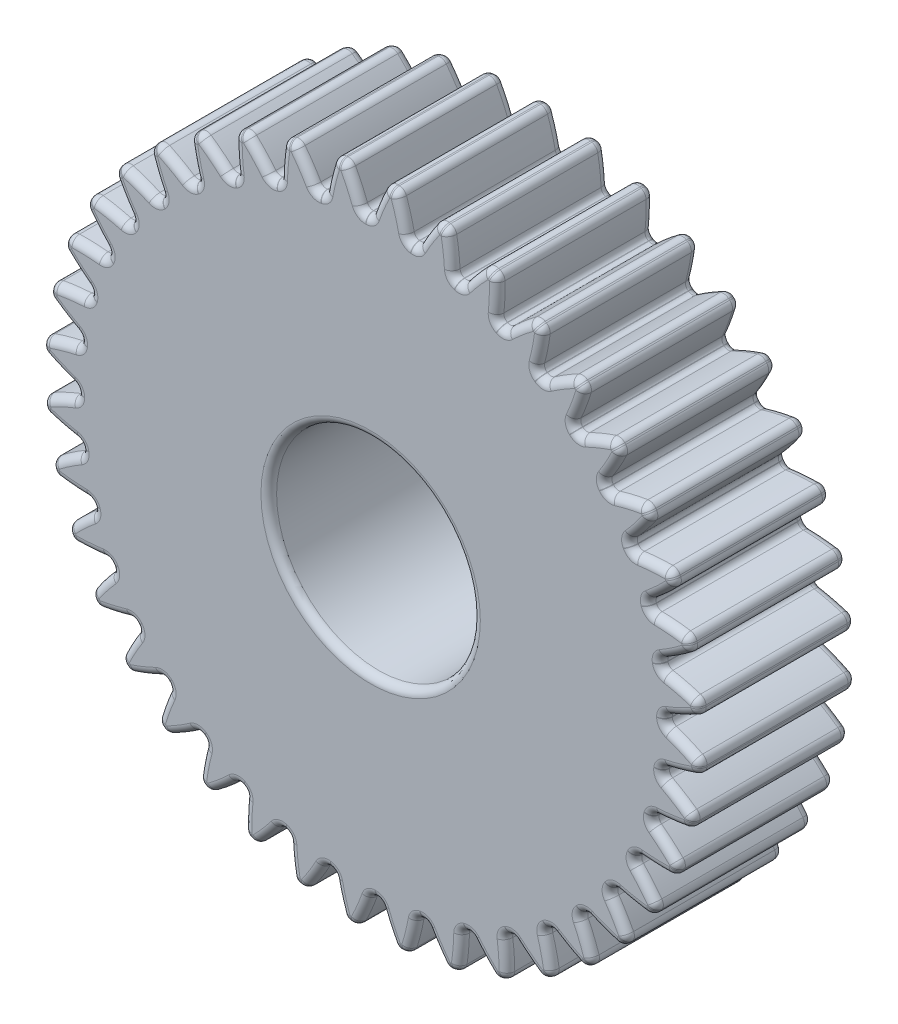
from build123d import *

# Parameters (mm, degrees)
SKETCH1_R                = 18.75
SKETCH1_R_2              = 6.5
BOSS_EXTRUDE5_DEPTH      = 10
BOSS_EXTRUDE6_DEPTH      = 10
FILLET3_R                = 0.5
FILLET4_R                = 0.4
CIRPATTERN5_COUNT        = 40
FILLET3_OF_CIRPATTERN5_R = 0.5
FILLET4_OF_CIRPATTERN5_R = 0.4
FILLET2_R                = 0.5
FILLET5_R                = 0.5


with BuildPart() as part:
    # Sketch1 → Boss-Extrude5 (new body)
    with BuildSketch(Plane(origin=(0, 0, 0), x_dir=(0, 1, 0), z_dir=(0, 0, 1))):
        with Locations(Location((0, 0, 0), (0, 0, 270))):
            Circle(SKETCH1_R)
        with Locations(Location((0, 0, 0), (0, 0, 270))):
            Circle(SKETCH1_R_2, mode=Mode.SUBTRACT)
    extrude(amount=BOSS_EXTRUDE5_DEPTH)

    # Sketch2 → Boss-Extrude6 (add)
    with BuildSketch(Plane(origin=(0, 0, 0), x_dir=(0, 1, 0), z_dir=(0, 0, 1))):
        with BuildLine():
            Line((2.32803618, 18.649105506), (2.322604084, 18.605590834))
            ThreePointArc((2.322604084, 18.605590834), (1.163544556, 18.713862885), (0, 18.75))
            Line((0, 18.75), (0, 18.793852416))
            ThreePointArc((0, 18.793852416), (0.418550324, 19.90662326), (0.931097056, 20.979348376))
            ThreePointArc((0.931097056, 20.979348376), (1.303169903, 20.959526431), (1.6748325, 20.933106222))
            ThreePointArc((1.6748325, 20.933106222), (2.050550849, 19.805152744), (2.32803618, 18.649105506))
        make_face()
    boss_extrude6 = extrude(amount=BOSS_EXTRUDE6_DEPTH)

    # Fillet3
    # the kernel refuses this fillet: 0.5 mm, written as the material it takes off along each edge
    with BuildSketch(Plane(origin=(-20.933106222, 1.6748325, -0.821430586), x_dir=(0.9384624251932158, 0.3453813493813292, 0), z_dir=(0, 0, 1))) as fillet3_piece_1:
        with BuildLine():
            CenterArc((0.322634488, -0.499964742), FILLET3_R, 89.31956844, 66.791728158)
            Line((-0.13453242, -0.297484081), (-0.143675758, -0.293434468))
            ThreePointArc((-0.143675758, -0.293434468), (-0.076955929, -0.14436002), (-0.009079275, 0.004191272))
            Line((-0.009079275, 0.004191272), (-0.000118755, 0.009999295))
            ThreePointArc((-0.000118755, 0.009999295), (0.164286117, 0.010975524), (0.328690989, 0.009999295))
            Line((0.328690989, 0.009999295), (0.328572234, 0))
        make_face()
    extrude(amount=11.642861172, mode=Mode.SUBTRACT)
    with BuildSketch(Plane(origin=(-20.979348376, 0.931097056, -0.821430586), x_dir=(0.05210254330850635, 0.998641740055354, 0), z_dir=(0, 0, 1))) as fillet3_piece_2:
        with BuildLine():
            CenterArc((0.32260326, -0.499984893), FILLET3_R, 89.554602616, 66.791728158)
            Line((-0.135390399, -0.299381284), (-0.144550273, -0.295369211))
            ThreePointArc((-0.144550273, -0.295369211), (-0.077695638, -0.145168103), (-0.009062006, 0.004228481))
            Line((-0.009062006, 0.004228481), (-7.7736e-05, 0.009999698))
            ThreePointArc((-7.7736e-05, 0.009999698), (0.163245023, 0.010634508), (0.326567782, 0.009999698))
            Line((0.326567782, 0.009999698), (0.326490046, 0))
        make_face()
    extrude(amount=11.642861172, mode=Mode.SUBTRACT)
    with BuildSketch(Plane(origin=(-18.793852416, 0, -0.190778807), x_dir=(1, 0, 0), z_dir=(0, 0, 1))) as fillet3_piece_3:
        with BuildLine():
            CenterArc((0.085924658, 0.498226782), FILLET3_R, 251.533712478, 13.639456333)
            Line((-0.072448649, 0.023971687), (-0.075616115, 0.014486585))
            ThreePointArc((-0.075616115, 0.014486585), (-0.039382147, 0.002442086), (-0.003115096, -0.00950243))
            Line((-0.003115096, -0.00950243), (0, -0.01))
            ThreePointArc((0, -0.01), (0.021926208, -0.01), (0.043010971, -0.009964536))
            Line((0.043010971, -0.009964536), (0.043852416, 0))
        make_face()
    extrude(amount=10.381557614, mode=Mode.SUBTRACT)
    with BuildSketch(Plane(origin=(-18.649105506, 2.32803618, -0.190778807), x_dir=(0.9922981777936071, -0.12387221781936024, 0), z_dir=(0, 0, 1))) as fillet3_piece_4:
        with BuildLine():
            CenterArc((0.085924658, -0.498226782), FILLET3_R, 94.826831189, 13.639456333)
            Line((-0.072448649, -0.023971687), (-0.075616115, -0.014486585))
            ThreePointArc((-0.075616115, -0.014486585), (-0.039382147, -0.002442086), (-0.003115096, 0.00950243))
            Line((-0.003115096, 0.00950243), (0, 0.01))
            ThreePointArc((0, 0.01), (0.021926208, 0.01), (0.043010971, 0.009964536))
            Line((0.043010971, 0.009964536), (0.043852416, 0))
        make_face()
    extrude(amount=10.381557614, mode=Mode.SUBTRACT)

    # Fillet4
    fillet4_edges = [part.edges().sort_by_distance(p)[0] for p in [
        (-18.75, 0, 5),
        (-18.605590834, 2.322604084, 5),
    ]]
    fillet(fillet4_edges, radius=FILLET4_R)

    # CirPattern5: Boss-Extrude6 ×40 about axis
    cirpattern5_axis = Axis((0, 0, 0), (0, 0, 1))
    for i in range(1, CIRPATTERN5_COUNT):
        add(boss_extrude6.rotate(cirpattern5_axis, i * 360 / CIRPATTERN5_COUNT))

    # Fillet3 of CirPattern5
    # the kernel refuses this fillet: 0.5 mm, written as the material it takes off along each edge
    with BuildSketch(Plane(origin=(-20.937386474, -1.620446741, -0.821430586), x_dir=(0.8728788488246356, 0.48793699928841117, 0), z_dir=(0, 0, 1)), Plane(origin=(-20.426118784, -4.875825205, -0.821430586), x_dir=(0.7858020982791726, 0.618478020902966, 0), z_dir=(0, 0, 1)), Plane(origin=(-19.411892259, -8.011144671, -0.821430586), x_dir=(0.6793762921464435, 0.7337900610320028, 0), z_dir=(0, 0, 1)), Plane(origin=(-17.919680522, -10.949203167, -0.821430586), x_dir=(0.5562219869804215, 0.8310337545488461, 0), z_dir=(0, 0, 1)), Plane(origin=(-15.986226779, -13.617655943, -0.821430586), x_dir=(0.419371650499999, 0.9078146389857936, 0), z_dir=(0, 0, 1)), Plane(origin=(-13.659139077, -15.950796835, -0.821430586), x_dir=(0.27219499216956267, 0.9622421141468562, 0), z_dir=(0, 0, 1)), Plane(origin=(-10.995718039, -17.891176172, -0.821430586), x_dir=(0.11831598976850975, 0.992975994959142, 0), z_dir=(0, 0, 1)), Plane(origin=(-8.06154593, -19.391015374, -0.821430586), x_dir=(-0.038476344968887695, 0.9992595112771432, 0), z_dir=(0, 0, 1)), Plane(origin=(-4.928871806, -20.413383422, -0.821430586), x_dir=(-0.19432126439748915, 0.9809379420753186, 0), z_dir=(0, 0, 1)), Plane(origin=(-1.6748325, -20.933106222, -0.821430586), x_dir=(-0.34538134938133047, 0.9384624251932153, 0), z_dir=(0, 0, 1)), Plane(origin=(1.620446741, -20.937386474, -0.821430586), x_dir=(-0.48793699928841117, 0.8728788488246356, 0), z_dir=(0, 0, 1)), Plane(origin=(4.875825205, -20.426118784, -0.821430586), x_dir=(-0.6184780209029541, 0.7858020982791819, 0), z_dir=(0, 0, 1)), Plane(origin=(8.011144671, -19.411892259, -0.821430586), x_dir=(-0.7337900610319971, 0.6793762921464497, 0), z_dir=(0, 0, 1)), Plane(origin=(10.949203167, -17.919680522, -0.821430586), x_dir=(-0.8310337545488444, 0.556221986980424, 0), z_dir=(0, 0, 1)), Plane(origin=(13.617655943, -15.986226779, -0.821430586), x_dir=(-0.9078146389857953, 0.41937165049999525, 0), z_dir=(0, 0, 1)), Plane(origin=(15.950796835, -13.659139077, -0.821430586), x_dir=(-0.9622421141468571, 0.2721949921695599, 0), z_dir=(0, 0, 1)), Plane(origin=(17.891176172, -10.995718039, -0.821430586), x_dir=(-0.9929759949591412, 0.11831598976851661, 0), z_dir=(0, 0, 1)), Plane(origin=(19.391015374, -8.06154593, -0.821430586), x_dir=(-0.999259511277143, -0.038476344968893926, 0), z_dir=(0, 0, 1)), Plane(origin=(20.413383422, -4.928871806, -0.821430586), x_dir=(-0.9809379420753189, -0.19432126439748706, 0), z_dir=(0, 0, 1)), Plane(origin=(20.933106222, -1.6748325, -0.821430586), x_dir=(-0.9384624251932158, -0.3453813493813292, 0), z_dir=(0, 0, 1)), Plane(origin=(20.937386474, 1.620446741, -0.821430586), x_dir=(-0.8728788488246382, -0.48793699928840656, 0), z_dir=(0, 0, 1)), Plane(origin=(20.426118784, 4.875825205, -0.821430586), x_dir=(-0.785802098279173, -0.6184780209029656, 0), z_dir=(0, 0, 1)), Plane(origin=(19.411892259, 8.011144671, -0.821430586), x_dir=(-0.6793762921464492, -0.7337900610319974, 0), z_dir=(0, 0, 1)), Plane(origin=(17.919680522, 10.949203167, -0.821430586), x_dir=(-0.556221986980419, -0.8310337545488478, 0), z_dir=(0, 0, 1)), Plane(origin=(15.986226779, 13.617655943, -0.821430586), x_dir=(-0.4193716505000007, -0.9078146389857927, 0), z_dir=(0, 0, 1)), Plane(origin=(13.659139077, 15.950796835, -0.821430586), x_dir=(-0.27219499216955834, -0.9622421141468576, 0), z_dir=(0, 0, 1)), Plane(origin=(10.995718039, 17.891176172, -0.821430586), x_dir=(-0.11831598976850594, -0.9929759949591423, 0), z_dir=(0, 0, 1)), Plane(origin=(8.06154593, 19.391015374, -0.821430586), x_dir=(0.0384763449688985, -0.9992595112771427, 0), z_dir=(0, 0, 1)), Plane(origin=(4.928871806, 20.413383422, -0.821430586), x_dir=(0.19432126439748915, -0.9809379420753186, 0), z_dir=(0, 0, 1)), Plane(origin=(1.6748325, 20.933106222, -0.821430586), x_dir=(0.34538134938132325, -0.9384624251932181, 0), z_dir=(0, 0, 1)), Plane(origin=(-1.620446741, 20.937386474, -0.821430586), x_dir=(0.48793699928840656, -0.8728788488246382, 0), z_dir=(0, 0, 1)), Plane(origin=(-4.875825205, 20.426118784, -0.821430586), x_dir=(0.6184780209029569, -0.7858020982791797, 0), z_dir=(0, 0, 1)), Plane(origin=(-8.011144671, 19.411892259, -0.821430586), x_dir=(0.7337900610320007, -0.6793762921464457, 0), z_dir=(0, 0, 1)), Plane(origin=(-10.949203167, 17.919680522, -0.821430586), x_dir=(0.8310337545488444, -0.556221986980424, 0), z_dir=(0, 0, 1)), Plane(origin=(-13.617655943, 15.986226779, -0.821430586), x_dir=(0.9078146389857934, -0.41937165049999897, 0), z_dir=(0, 0, 1)), Plane(origin=(-15.950796835, 13.659139077, -0.821430586), x_dir=(0.9622421141468571, -0.2721949921695599, 0), z_dir=(0, 0, 1)), Plane(origin=(-17.891176172, 10.995718039, -0.821430586), x_dir=(0.9929759949591414, -0.11831598976851379, 0), z_dir=(0, 0, 1)), Plane(origin=(-19.391015374, 8.06154593, -0.821430586), x_dir=(0.999259511277143, 0.038476344968893926, 0), z_dir=(0, 0, 1))) as fillet3_of_cirpattern5_piece_1:
        with BuildLine():
            CenterArc((0.322634488, -0.499964742), FILLET3_OF_CIRPATTERN5_R, 89.31956844, 66.791728158)
            Line((-0.13453242, -0.297484081), (-0.143675758, -0.293434468))
            ThreePointArc((-0.143675758, -0.293434468), (-0.076955929, -0.14436002), (-0.009079275, 0.004191272))
            Line((-0.009079275, 0.004191272), (-0.000118755, 0.009999295))
            ThreePointArc((-0.000118755, 0.009999295), (0.164286117, 0.010975524), (0.328690989, 0.009999295))
            Line((0.328690989, 0.009999295), (0.328572234, 0))
        make_face()
    extrude(amount=11.642861172, mode=Mode.SUBTRACT)
    with BuildSketch(Plane(origin=(-20.866713454, -2.362259434, -0.821430586), x_dir=(-0.10476091183123108, 0.994497436574016, 0), z_dir=(0, 0, 1)), Plane(origin=(-20.240270794, -5.597449257, -0.821430586), x_dir=(-0.2590448056401441, 0.9658653056564668, 0), z_dir=(0, 0, 1)), Plane(origin=(-19.115445494, -8.694811302, -0.821430586), x_dir=(-0.4069501566137963, 0.9134503653904829, 0), z_dir=(0, 0, 1)), Plane(origin=(-17.519934485, -11.578078236, -0.821430586), x_dir=(-0.5448350441414761, 0.8385432455606305, 0), z_dir=(0, 0, 1)), Plane(origin=(-15.493024544, -14.176254459, -0.821430586), x_dir=(-0.6693042846785545, 0.7429884080595932, 0), z_dir=(0, 0, 1)), Plane(origin=(-13.08462492, -16.425364249, -0.821430586), x_dir=(-0.777293032433268, 0.629138730114984, 0), z_dir=(0, 0, 1)), Plane(origin=(-10.354038405, -18.270027058, -0.821430586), x_dir=(-0.8661422460418021, 0.4997975686432082, 0), z_dir=(0, 0, 1)), Plane(origin=(-7.368501101, -19.664821167, -0.821430586), x_dir=(-0.9336641629914852, 0.35814973229839075, 0), z_dir=(0, 0, 1)), Plane(origin=(-4.201526846, -20.575402114, -0.821430586), x_dir=(-0.9781961695946072, 0.20768306091359082, 0), z_dir=(0, 0, 1)), Plane(origin=(-0.931097056, -20.979348376, -0.821430586), x_dir=(-0.9986417400553536, 0.05210254330851695, 0), z_dir=(0, 0, 1)), Plane(origin=(2.362259434, -20.866713454, -0.821430586), x_dir=(-0.994497436574016, -0.10476091183123051, 0), z_dir=(0, 0, 1)), Plane(origin=(5.597449257, -20.240270794, -0.821430586), x_dir=(-0.9658653056564642, -0.2590448056401536, 0), z_dir=(0, 0, 1)), Plane(origin=(8.694811302, -19.115445494, -0.821430586), x_dir=(-0.9134503653904829, -0.4069501566137963, 0), z_dir=(0, 0, 1)), Plane(origin=(11.578078236, -17.519934485, -0.821430586), x_dir=(-0.8385432455606239, -0.5448350441414864, 0), z_dir=(0, 0, 1)), Plane(origin=(14.176254459, -15.493024544, -0.821430586), x_dir=(-0.7429884080595961, -0.6693042846785512, 0), z_dir=(0, 0, 1)), Plane(origin=(16.425364249, -13.08462492, -0.821430586), x_dir=(-0.6291387301149892, -0.7772930324332638, 0), z_dir=(0, 0, 1)), Plane(origin=(18.270027058, -10.354038405, -0.821430586), x_dir=(-0.4997975686432082, -0.8661422460418021, 0), z_dir=(0, 0, 1)), Plane(origin=(19.664821167, -7.368501101, -0.821430586), x_dir=(-0.3581497322983939, -0.9336641629914841, 0), z_dir=(0, 0, 1)), Plane(origin=(20.575402114, -4.201526846, -0.821430586), x_dir=(-0.20768306091359362, -0.9781961695946068, 0), z_dir=(0, 0, 1)), Plane(origin=(20.979348376, -0.931097056, -0.821430586), x_dir=(-0.052102543308517026, -0.9986417400553536, 0), z_dir=(0, 0, 1)), Plane(origin=(20.866713454, 2.362259434, -0.821430586), x_dir=(0.10476091183123037, -0.994497436574016, 0), z_dir=(0, 0, 1)), Plane(origin=(20.240270794, 5.597449257, -0.821430586), x_dir=(0.2590448056401421, -0.9658653056564674, 0), z_dir=(0, 0, 1)), Plane(origin=(19.115445494, 8.694811302, -0.821430586), x_dir=(0.4069501566137963, -0.9134503653904829, 0), z_dir=(0, 0, 1)), Plane(origin=(17.519934485, 11.578078236, -0.821430586), x_dir=(0.5448350441414838, -0.8385432455606255, 0), z_dir=(0, 0, 1)), Plane(origin=(15.493024544, 14.176254459, -0.821430586), x_dir=(0.6693042846785542, -0.7429884080595934, 0), z_dir=(0, 0, 1)), Plane(origin=(13.08462492, 16.425364249, -0.821430586), x_dir=(0.7772930324332648, -0.629138730114988, 0), z_dir=(0, 0, 1)), Plane(origin=(10.354038405, 18.270027058, -0.821430586), x_dir=(0.8661422460418056, -0.4997975686432024, 0), z_dir=(0, 0, 1)), Plane(origin=(7.368501101, 19.664821167, -0.821430586), x_dir=(0.9336641629914857, -0.35814973229838987, 0), z_dir=(0, 0, 1)), Plane(origin=(4.201526846, 20.575402114, -0.821430586), x_dir=(0.9781961695946071, -0.20768306091359195, 0), z_dir=(0, 0, 1)), Plane(origin=(0.931097056, 20.979348376, -0.821430586), x_dir=(0.9986417400553536, -0.0521025433085175, 0), z_dir=(0, 0, 1)), Plane(origin=(-2.362259434, 20.866713454, -0.821430586), x_dir=(0.994497436574016, 0.10476091183123051, 0), z_dir=(0, 0, 1)), Plane(origin=(-5.597449257, 20.240270794, -0.821430586), x_dir=(0.965865305656465, 0.25904480564015087, 0), z_dir=(0, 0, 1)), Plane(origin=(-8.694811302, 19.115445494, -0.821430586), x_dir=(0.9134503653904787, 0.4069501566138054, 0), z_dir=(0, 0, 1)), Plane(origin=(-11.578078236, 17.519934485, -0.821430586), x_dir=(0.8385432455606221, 0.5448350441414889, 0), z_dir=(0, 0, 1)), Plane(origin=(-14.176254459, 15.493024544, -0.821430586), x_dir=(0.7429884080595938, 0.6693042846785539, 0), z_dir=(0, 0, 1)), Plane(origin=(-16.425364249, 13.08462492, -0.821430586), x_dir=(0.6291387301149892, 0.7772930324332638, 0), z_dir=(0, 0, 1)), Plane(origin=(-18.270027058, 10.354038405, -0.821430586), x_dir=(0.49979756864319763, 0.8661422460418081, 0), z_dir=(0, 0, 1)), Plane(origin=(-19.664821167, 7.368501101, -0.821430586), x_dir=(0.35814973229838715, 0.9336641629914868, 0), z_dir=(0, 0, 1)), Plane(origin=(-20.575402114, 4.201526846, -0.821430586), x_dir=(0.2076830609135903, 0.9781961695946074, 0), z_dir=(0, 0, 1))) as fillet3_of_cirpattern5_piece_2:
        with BuildLine():
            CenterArc((0.32260326, -0.499984893), FILLET3_OF_CIRPATTERN5_R, 89.554602616, 66.791728158)
            Line((-0.135390399, -0.299381284), (-0.144550273, -0.295369211))
            ThreePointArc((-0.144550273, -0.295369211), (-0.077695638, -0.145168103), (-0.009062006, 0.004228481))
            Line((-0.009062006, 0.004228481), (-7.7736e-05, 0.009999698))
            ThreePointArc((-7.7736e-05, 0.009999698), (0.163245023, 0.010634508), (0.326567782, 0.009999698))
            Line((0.326567782, 0.009999698), (0.326490046, 0))
        make_face()
    extrude(amount=11.642861172, mode=Mode.SUBTRACT)
    with BuildSketch(Plane(origin=(-18.562468906, -2.940006249, -0.190778807), x_dir=(-0.9868324100223466, 0.16174608041460278, 0), z_dir=(0, 0, 1)), Plane(origin=(-16.745445117, -8.53223045, -0.190778807), x_dir=(-0.9885156816646515, -0.15111832153339072, 0), z_dir=(0, 0, 1)), Plane(origin=(-15.204545994, -11.046749284, -0.190778807), x_dir=(-0.9527052994887785, -0.3038957260739235, 0), z_dir=(0, 0, 1)), Plane(origin=(-13.289260488, -13.289260488, -0.190778807), x_dir=(-0.8934361509918739, -0.4491902092664371, 0), z_dir=(0, 0, 1)), Plane(origin=(-11.046749284, -15.204545994, -0.190778807), x_dir=(-0.812167639312964, -0.5834241387299699, 0), z_dir=(0, 0, 1)), Plane(origin=(-8.53223045, -16.745445117, -0.190778807), x_dir=(-0.7109008649243174, -0.7032922296242562, 0), z_dir=(0, 0, 1)), Plane(origin=(-5.807619786, -17.874015806, -0.190778807), x_dir=(-0.592129351896542, -0.805842931732097, 0), z_dir=(0, 0, 1)), Plane(origin=(-2.940006249, -18.562468906, -0.190778807), x_dir=(-0.45877764906038127, -0.8885511064213637, 0), z_dir=(0, 0, 1)), Plane(origin=(0, -18.793852416, -0.190778807), x_dir=(-0.3141293179087008, -0.9493802039384508, 0), z_dir=(0, 0, 1)), Plane(origin=(2.940006249, -18.562468906, -0.190778807), x_dir=(-0.16174608041459537, -0.9868324100223479, 0), z_dir=(0, 0, 1)), Plane(origin=(5.807619786, -17.874015806, -0.190778807), x_dir=(-0.0053801176162308825, -0.9999855270624848, 0), z_dir=(0, 0, 1)), Plane(origin=(8.53223045, -16.745445117, -0.190778807), x_dir=(0.15111832153338375, -0.9885156816646526, 0), z_dir=(0, 0, 1)), Plane(origin=(11.046749284, -15.204545994, -0.190778807), x_dir=(0.30389572607391585, -0.9527052994887807, 0), z_dir=(0, 0, 1)), Plane(origin=(13.289260488, -13.289260488, -0.190778807), x_dir=(0.44919020926643694, -0.893436150991874, 0), z_dir=(0, 0, 1)), Plane(origin=(15.204545994, -11.046749284, -0.190778807), x_dir=(0.5834241387299526, -0.8121676393129765, 0), z_dir=(0, 0, 1)), Plane(origin=(16.745445117, -8.53223045, -0.190778807), x_dir=(0.7032922296242673, -0.7109008649243064, 0), z_dir=(0, 0, 1)), Plane(origin=(17.874015806, -5.807619786, -0.190778807), x_dir=(0.8058429317321029, -0.5921293518965339, 0), z_dir=(0, 0, 1)), Plane(origin=(18.562468906, -2.940006249, -0.190778807), x_dir=(0.8885511064213542, -0.4587776490603996, 0), z_dir=(0, 0, 1)), Plane(origin=(18.793852416, 0, -0.190778807), x_dir=(0.9493802039384597, -0.31412931790867404, 0), z_dir=(0, 0, 1)), Plane(origin=(18.562468906, 2.940006249, -0.190778807), x_dir=(0.9868324100223466, -0.16174608041460278, 0), z_dir=(0, 0, 1)), Plane(origin=(17.874015806, 5.807619786, -0.190778807), x_dir=(0.9999855270624848, -0.0053801176162308825, 0), z_dir=(0, 0, 1)), Plane(origin=(16.745445117, 8.53223045, -0.190778807), x_dir=(0.9885156816646467, 0.15111832153342228, 0), z_dir=(0, 0, 1)), Plane(origin=(15.204545994, 11.046749284, -0.190778807), x_dir=(0.9527052994887738, 0.3038957260739379, 0), z_dir=(0, 0, 1)), Plane(origin=(13.289260488, 13.289260488, -0.190778807), x_dir=(0.8934361509918785, 0.449190209266428, 0), z_dir=(0, 0, 1)), Plane(origin=(11.046749284, 15.204545994, -0.190778807), x_dir=(0.8121676393129765, 0.5834241387299526, 0), z_dir=(0, 0, 1)), Plane(origin=(8.53223045, 16.745445117, -0.190778807), x_dir=(0.7109008649242824, 0.7032922296242916, 0), z_dir=(0, 0, 1)), Plane(origin=(5.807619786, 17.874015806, -0.190778807), x_dir=(0.5921293518965349, 0.8058429317321022, 0), z_dir=(0, 0, 1)), Plane(origin=(2.940006249, 18.562468906, -0.190778807), x_dir=(0.45877764906040025, 0.888551106421354, 0), z_dir=(0, 0, 1)), Plane(origin=(0, 18.793852416, -0.190778807), x_dir=(0.3141293179086672, 0.9493802039384618, 0), z_dir=(0, 0, 1)), Plane(origin=(-2.940006249, 18.562468906, -0.190778807), x_dir=(0.16174608041459537, 0.9868324100223479, 0), z_dir=(0, 0, 1)), Plane(origin=(-5.807619786, 17.874015806, -0.190778807), x_dir=(0.005380117616231384, 0.9999855270624848, 0), z_dir=(0, 0, 1)), Plane(origin=(-8.53223045, 16.745445117, -0.190778807), x_dir=(-0.15111832153341156, 0.9885156816646483, 0), z_dir=(0, 0, 1)), Plane(origin=(-11.046749284, 15.204545994, -0.190778807), x_dir=(-0.30389572607392934, 0.9527052994887765, 0), z_dir=(0, 0, 1)), Plane(origin=(-13.289260488, 13.289260488, -0.190778807), x_dir=(-0.44919020926642766, 0.8934361509918786, 0), z_dir=(0, 0, 1)), Plane(origin=(-15.204545994, 11.046749284, -0.190778807), x_dir=(-0.583424138729966, 0.8121676393129669, 0), z_dir=(0, 0, 1)), Plane(origin=(-16.745445117, 8.53223045, -0.190778807), x_dir=(-0.7032922296242916, 0.7109008649242824, 0), z_dir=(0, 0, 1)), Plane(origin=(-17.874015806, 5.807619786, -0.190778807), x_dir=(-0.8058429317321241, 0.5921293518965052, 0), z_dir=(0, 0, 1))) as fillet3_of_cirpattern5_piece_3:
        with BuildLine():
            CenterArc((0.07493247, -0.499998098), FILLET3_OF_CIRPATTERN5_R, 89.841971998, 13.639456333)
            Line((-0.041632615, -0.013775329), (-0.043963917, -0.004050874))
            ThreePointArc((-0.043963917, -0.004050874), (-0.023957601, 0.002606137), (-0.003141293, 0.009493802))
            Line((-0.003141293, 0.009493802), (-2.7581e-05, 0.009999962))
            ThreePointArc((-2.7581e-05, 0.009999962), (0.038155761, 0.010052619), (0.076339104, 0.009999962))
            Line((0.076339104, 0.009999962), (0.076311523, 0))
        make_face()
    extrude(amount=10.381557614, mode=Mode.SUBTRACT)
    with BuildSketch(Plane(origin=(-18.783689165, -0.617988652, -0.190778807), x_dir=(0.9994592247284663, 0.03288248933966567, 0), z_dir=(0, 0, 1)), Plane(origin=(-18.455756058, -3.548796552, -0.190778807), x_dir=(0.9820102685354974, 0.18882752048057064, 0), z_dir=(0, 0, 1)), Plane(origin=(-17.673380985, -6.392221303, -0.190778807), x_dir=(0.9403809604259679, 0.3401229913844905, 0), z_dir=(0, 0, 1)), Plane(origin=(-16.455828618, -9.078248352, -0.190778807), x_dir=(0.8755963521253076, 0.4830435054369887, 0), z_dir=(0, 0, 1)), Plane(origin=(-14.833079136, -11.540738796, -0.190778807), x_dir=(0.7892516556976134, 0.6140698852562109, 0), z_dir=(0, 0, 1)), Plane(origin=(-12.845090018, -13.719057951, -0.190778807), x_dir=(0.6834729641304829, 0.7299758265194073, 0), z_dir=(0, 0, 1)), Plane(origin=(-10.540812153, -15.559568367, -0.190778807), x_dir=(0.5608648998698184, 0.8279073402827266, 0), z_dir=(0, 0, 1)), Plane(origin=(-7.97698451, -17.016950571, -0.190778807), x_dir=(0.4244464803704946, 0.9054530276613466, 0), z_dir=(0, 0, 1)), Plane(origin=(-5.216737035, -18.055318976, -0.190778807), x_dir=(0.27757677986735146, 0.960703456472637, 0), z_dir=(0, 0, 1)), Plane(origin=(-2.32803618, -18.649105506, -0.190778807), x_dir=(0.12387221781932034, 0.992298177793612, 0), z_dir=(0, 0, 1)), Plane(origin=(0.617988652, -18.783689165, -0.190778807), x_dir=(-0.03288248933972597, 0.9994592247284643, 0), z_dir=(0, 0, 1)), Plane(origin=(3.548796552, -18.455756058, -0.190778807), x_dir=(-0.1888275204805323, 0.9820102685355048, 0), z_dir=(0, 0, 1)), Plane(origin=(6.392221303, -17.673380985, -0.190778807), x_dir=(-0.3401229913844227, 0.9403809604259925, 0), z_dir=(0, 0, 1)), Plane(origin=(9.078248352, -16.455828618, -0.190778807), x_dir=(-0.48304350543710656, 0.8755963521252428, 0), z_dir=(0, 0, 1)), Plane(origin=(11.540738796, -14.833079136, -0.190778807), x_dir=(-0.6140698852562165, 0.789251655697609, 0), z_dir=(0, 0, 1)), Plane(origin=(13.719057951, -12.845090018, -0.190778807), x_dir=(-0.7299758265193923, 0.683472964130499, 0), z_dir=(0, 0, 1)), Plane(origin=(15.559568367, -10.540812153, -0.190778807), x_dir=(-0.8279073402827012, 0.560864899869856, 0), z_dir=(0, 0, 1)), Plane(origin=(17.016950571, -7.97698451, -0.190778807), x_dir=(-0.905453027661336, 0.42444648037051746, 0), z_dir=(0, 0, 1)), Plane(origin=(18.055318976, -5.216737035, -0.190778807), x_dir=(-0.960703456472645, 0.2775767798673241, 0), z_dir=(0, 0, 1)), Plane(origin=(18.649105506, -2.32803618, -0.190778807), x_dir=(-0.992298177793612, 0.12387221781932034, 0), z_dir=(0, 0, 1)), Plane(origin=(18.783689165, 0.617988652, -0.190778807), x_dir=(-0.999459224728463, -0.03288248933975871, 0), z_dir=(0, 0, 1)), Plane(origin=(18.455756058, 3.548796552, -0.190778807), x_dir=(-0.9820102685355058, -0.18882752048052703, 0), z_dir=(0, 0, 1)), Plane(origin=(17.673380985, 6.392221303, -0.190778807), x_dir=(-0.9403809604259635, -0.3401229913845023, 0), z_dir=(0, 0, 1)), Plane(origin=(16.455828618, 9.078248352, -0.190778807), x_dir=(-0.8755963521252942, -0.4830435054370134, 0), z_dir=(0, 0, 1)), Plane(origin=(14.833079136, 11.540738796, -0.190778807), x_dir=(-0.7892516556975849, -0.6140698852562473, 0), z_dir=(0, 0, 1)), Plane(origin=(12.845090018, 13.719057951, -0.190778807), x_dir=(-0.6834729641304773, -0.7299758265194124, 0), z_dir=(0, 0, 1)), Plane(origin=(10.540812153, 15.559568367, -0.190778807), x_dir=(-0.5608648998698372, -0.8279073402827138, 0), z_dir=(0, 0, 1)), Plane(origin=(7.97698451, 17.016950571, -0.190778807), x_dir=(-0.42444648037047794, -0.9054530276613543, 0), z_dir=(0, 0, 1)), Plane(origin=(5.216737035, 18.055318976, -0.190778807), x_dir=(-0.2775767798672464, -0.9607034564726673, 0), z_dir=(0, 0, 1)), Plane(origin=(2.32803618, 18.649105506, -0.190778807), x_dir=(-0.12387221781932038, -0.9922981777936121, 0), z_dir=(0, 0, 1)), Plane(origin=(-0.617988652, 18.783689165, -0.190778807), x_dir=(0.03288248933972077, -0.9994592247284644, 0), z_dir=(0, 0, 1)), Plane(origin=(-3.548796552, 18.455756058, -0.190778807), x_dir=(0.18882752048055634, -0.9820102685355001, 0), z_dir=(0, 0, 1)), Plane(origin=(-6.392221303, 17.673380985, -0.190778807), x_dir=(0.34012299138441093, -0.9403809604259967, 0), z_dir=(0, 0, 1)), Plane(origin=(-9.078248352, 16.455828618, -0.190778807), x_dir=(0.48304350543704444, -0.875596352125277, 0), z_dir=(0, 0, 1)), Plane(origin=(-11.540738796, 14.833079136, -0.190778807), x_dir=(0.6140698852562642, -0.7892516556975719, 0), z_dir=(0, 0, 1)), Plane(origin=(-13.719057951, 12.845090018, -0.190778807), x_dir=(0.7299758265194313, -0.683472964130457, 0), z_dir=(0, 0, 1)), Plane(origin=(-15.559568367, 10.540812153, -0.190778807), x_dir=(0.8279073402827206, -0.5608648998698273, 0), z_dir=(0, 0, 1)), Plane(origin=(-17.016950571, 7.97698451, -0.190778807), x_dir=(0.905453027661364, -0.42444648037045724, 0), z_dir=(0, 0, 1)), Plane(origin=(-18.055318976, 5.216737035, -0.190778807), x_dir=(0.9607034564726441, -0.277576779867327, 0), z_dir=(0, 0, 1))) as fillet3_of_cirpattern5_piece_4:
        with BuildLine():
            CenterArc((0.085924658, -0.498226782), FILLET3_OF_CIRPATTERN5_R, 94.826831189, 13.639456333)
            Line((-0.072448649, -0.023971687), (-0.075616115, -0.014486585))
            ThreePointArc((-0.075616115, -0.014486585), (-0.039382147, -0.002442086), (-0.003115096, 0.00950243))
            Line((-0.003115096, 0.00950243), (0, 0.01))
            ThreePointArc((0, 0.01), (0.021926208, 0.01), (0.043010971, 0.009964536))
            Line((0.043010971, 0.009964536), (0.043852416, 0))
        make_face()
    extrude(amount=10.381557614, mode=Mode.SUBTRACT)
    with BuildSketch(Plane(origin=(-17.874015806, -5.807619786, -0.190778807), x_dir=(0.9510565162951229, 0.3090169943750417, 0), z_dir=(0, 0, 1)), Plane(origin=(-18.562468906, 2.940006249, -0.190778807), x_dir=(0.9876883405951539, -0.15643446504012937, 0), z_dir=(0, 0, 1))) as fillet3_of_cirpattern5_piece_5:
        with BuildLine():
            CenterArc((0.085924658, 0.498226782), FILLET3_OF_CIRPATTERN5_R, 251.533712478, 13.639456333)
            Line((-0.072448649, 0.023971687), (-0.075616115, 0.014486585))
            ThreePointArc((-0.075616115, 0.014486585), (-0.039382147, 0.002442086), (-0.003115096, -0.00950243))
            Line((-0.003115096, -0.00950243), (0, -0.01))
            ThreePointArc((0, -0.01), (0.021926208, -0.01), (0.043010971, -0.009964536))
            Line((0.043010971, -0.009964536), (0.043852416, 0))
        make_face()
    extrude(amount=10.381557614, mode=Mode.SUBTRACT)
    with BuildSketch(Plane(origin=(-20.413383422, 4.928871806, -0.821430586), x_dir=(-0.22714466499801628, -0.9738610276435435, 0), z_dir=(0, 0, 1))) as fillet3_of_cirpattern5_piece_6:
        with BuildLine():
            CenterArc((0.32260326, 0.499984893), FILLET3_OF_CIRPATTERN5_R, 203.653669225, 66.791728158)
            Line((-0.135390399, 0.299381284), (-0.144550273, 0.295369211))
            ThreePointArc((-0.144550273, 0.295369211), (-0.077695638, 0.145168103), (-0.009062006, -0.004228481))
            Line((-0.009062006, -0.004228481), (-7.7736e-05, -0.009999698))
            ThreePointArc((-7.7736e-05, -0.009999698), (0.163245023, -0.010634508), (0.326567782, -0.009999698))
            Line((0.326567782, -0.009999698), (0.326490046, 0))
        make_face()
    extrude(amount=11.642861172, mode=Mode.SUBTRACT)

    # Fillet4 of CirPattern5
    fillet4_of_cirpattern5_edges = [part.edges().sort_by_distance(p)[0] for p in [
        (-18.519156386, -2.93314622, 5),
        (-18.739860464, -0.616546675, 5),
        (-17.832309681, -5.794068645, 5),
        (-18.412692535, -3.540516009, 5),
        (-16.706372329, -8.51232187, 5),
        (-17.632143008, -6.377306088, 5),
        (-15.169068645, -11.02097348, 5),
        (-16.417431602, -9.057065727, 5),
        (-13.258252147, -13.258252147, 5),
        (-14.798468544, -11.513810349, 5),
        (-11.02097348, -15.169068645, 5),
        (-12.815118077, -13.687046747, 5),
        (-8.51232187, -16.706372329, 5),
        (-10.516216873, -15.52326263, 5),
        (-5.794068645, -17.832309681, 5),
        (-7.958371507, -16.977244269, 5),
        (-2.93314622, -18.519156386, 5),
        (-5.204564623, -18.013189809, 5),
        (0, -18.75, 5),
        (-2.322604084, -18.605590834, 5),
        (2.93314622, -18.519156386, 5),
        (0.616546675, -18.739860464, 5),
        (5.794068645, -17.832309681, 5),
        (3.540516009, -18.412692535, 5),
        (8.51232187, -16.706372329, 5),
        (6.377306088, -17.632143008, 5),
        (11.02097348, -15.169068645, 5),
        (9.057065727, -16.417431602, 5),
        (13.258252147, -13.258252147, 5),
        (11.513810349, -14.798468544, 5),
        (15.169068645, -11.02097348, 5),
        (13.687046747, -12.815118077, 5),
        (16.706372329, -8.51232187, 5),
        (15.52326263, -10.516216873, 5),
        (17.832309681, -5.794068645, 5),
        (16.977244269, -7.958371507, 5),
        (18.519156386, -2.93314622, 5),
        (18.013189809, -5.204564623, 5),
        (18.75, 0, 5),
        (18.605590834, -2.322604084, 5),
        (18.519156386, 2.93314622, 5),
        (18.739860464, 0.616546675, 5),
        (17.832309681, 5.794068645, 5),
        (18.412692535, 3.540516009, 5),
        (16.706372329, 8.51232187, 5),
        (17.632143008, 6.377306088, 5),
        (15.169068645, 11.02097348, 5),
        (16.417431602, 9.057065727, 5),
        (13.258252147, 13.258252147, 5),
        (14.798468544, 11.513810349, 5),
        (11.02097348, 15.169068645, 5),
        (12.815118077, 13.687046747, 5),
        (8.51232187, 16.706372329, 5),
        (10.516216873, 15.52326263, 5),
        (5.794068645, 17.832309681, 5),
        (7.958371507, 16.977244269, 5),
        (2.93314622, 18.519156386, 5),
        (5.204564623, 18.013189809, 5),
        (0, 18.75, 5),
        (2.322604084, 18.605590834, 5),
        (-2.93314622, 18.519156386, 5),
        (-0.616546675, 18.739860464, 5),
        (-5.794068645, 17.832309681, 5),
        (-3.540516009, 18.412692535, 5),
        (-8.51232187, 16.706372329, 5),
        (-6.377306088, 17.632143008, 5),
        (-11.02097348, 15.169068645, 5),
        (-9.057065727, 16.417431602, 5),
        (-13.258252147, 13.258252147, 5),
        (-11.513810349, 14.798468544, 5),
        (-15.169068645, 11.02097348, 5),
        (-13.687046747, 12.815118077, 5),
        (-16.706372329, 8.51232187, 5),
        (-15.52326263, 10.516216873, 5),
        (-17.832309681, 5.794068645, 5),
        (-16.977244269, 7.958371507, 5),
        (-18.519156386, 2.93314622, 5),
        (-18.013189809, 5.204564623, 5),
    ]]
    fillet(fillet4_of_cirpattern5_edges, radius=FILLET4_OF_CIRPATTERN5_R)

    # Fillet2
    fillet2_edges = [part.edges().sort_by_distance(p)[0] for p in [
        (-6.5, 0, 10),
    ]]
    fillet(fillet2_edges, radius=FILLET2_R)

    # Fillet5
    fillet5_edges = [part.edges().sort_by_distance(p)[0] for p in [
        (-15.834675016, 11.999352002, 10),
        (-13.899142994, 15.742103545, 0),
        (-13.899142994, 15.742103545, 10),
        (-13.76261168, 14.328708983, 0),
        (-13.76261168, 14.328708983, 10),
        (-11.265413933, 17.722597127, 0),
        (-11.265413933, 17.722597127, 10),
        (-11.351667168, 16.305245594, 0),
        (-11.351667168, 16.305245594, 10),
        (-8.354292993, 19.266701549, 0),
        (-8.354292993, 19.266701549, 10),
        (-8.661206936, 17.880292944, 0),
        (-8.661206936, 17.880292944, 10),
        (-5.237461633, 20.336395837, 0),
        (-5.237461633, 20.336395837, 10),
        (-5.757479045, 19.015068141, 0),
        (-5.757479045, 19.015068141, 10),
        (-1.991666586, 20.905340567, 0),
        (-1.991666586, 20.905340567, 10),
        (-2.711982911, 19.681629253, 0),
        (-2.711982911, 19.681629253, 10),
        (1.303169903, 20.959526431, 0),
        (1.303169903, 20.959526431, 10),
        (0.400291242, 19.863563333, 0),
        (0.400291242, 19.863563333, 10),
        (4.565918024, 20.497619193, 0),
        (4.565918024, 20.497619193, 10),
        (3.502708896, 19.55639056, 0),
        (3.502708896, 19.55639056, 10),
        (7.716238089, 19.530992544, 0),
        (7.716238089, 19.530992544, 10),
        (6.518878233, 18.767674548, 0),
        (6.518878233, 18.767674548, 10),
        (10.676558764, 18.083448038, 0),
        (10.676558764, 18.083448038, 10),
        (9.374531152, 17.516836102, 0),
        (9.374531152, 17.516836102, 10),
        (13.373987129, 16.190629026, 0),
        (13.373987129, 16.190629026, 10),
        (11.999352002, 15.834675016, 0),
        (11.999352002, 15.834675016, 10),
        (15.742103545, 13.899142994, 0),
        (15.742103545, 13.899142994, 10),
        (14.328708983, 13.76261168, 0),
        (14.328708983, 13.76261168, 10),
        (17.722597127, 11.265413933, 0),
        (17.722597127, 11.265413933, 10),
        (16.305245594, 11.351667168, 0),
        (16.305245594, 11.351667168, 10),
        (19.266701549, 8.354292993, 0),
        (19.266701549, 8.354292993, 10),
        (17.880292944, 8.661206936, 0),
        (17.880292944, 8.661206936, 10),
        (20.336395837, 5.237461633, 0),
        (20.336395837, 5.237461633, 10),
        (19.015068141, 5.757479045, 0),
        (19.015068141, 5.757479045, 10),
        (20.905340567, 1.991666586, 0),
        (20.905340567, 1.991666586, 10),
        (19.681629253, 2.711982911, 0),
        (19.681629253, 2.711982911, 10),
        (20.959526431, -1.303169903, 0),
        (20.959526431, -1.303169903, 10),
        (19.863563333, -0.400291242, 0),
        (19.863563333, -0.400291242, 10),
        (20.497619193, -4.565918024, 0),
        (20.497619193, -4.565918024, 10),
        (19.55639056, -3.502708896, 0),
        (19.55639056, -3.502708896, 10),
        (19.530992544, -7.716238089, 0),
        (19.530992544, -7.716238089, 10),
        (18.767674548, -6.518878233, 0),
        (18.767674548, -6.518878233, 10),
        (18.083448038, -10.676558764, 0),
        (18.083448038, -10.676558764, 10),
        (17.516836102, -9.374531152, 0),
        (17.516836102, -9.374531152, 10),
        (-20.959526431, 1.303169903, 0),
        (16.190629026, -13.373987129, 0),
        (16.190629026, -13.373987129, 10),
        (15.834675016, -11.999352002, 0),
        (-20.959526431, 1.303169903, 10),
        (15.834675016, -11.999352002, 10),
        (13.899142994, -15.742103545, 0),
        (13.899142994, -15.742103545, 10),
        (13.76261168, -14.328708983, 0),
        (13.76261168, -14.328708983, 10),
        (11.265413933, -17.722597127, 0),
        (11.265413933, -17.722597127, 10),
        (11.351667168, -16.305245594, 0),
        (-19.863563333, 0.400291242, 0),
        (11.351667168, -16.305245594, 10),
        (8.354292993, -19.266701549, 0),
        (8.354292993, -19.266701549, 10),
        (8.661206936, -17.880292944, 0),
        (8.661206936, -17.880292944, 10),
        (5.237461633, -20.336395837, 0),
        (5.237461633, -20.336395837, 10),
        (5.757479045, -19.015068141, 0),
        (5.757479045, -19.015068141, 10),
        (1.991666586, -20.905340567, 0),
        (1.991666586, -20.905340567, 10),
        (2.711982911, -19.681629253, 0),
        (2.711982911, -19.681629253, 10),
        (-1.303169903, -20.959526431, 0),
        (-1.303169903, -20.959526431, 10),
        (-0.400291242, -19.863563333, 0),
        (-0.400291242, -19.863563333, 10),
        (-4.565918024, -20.497619193, 0),
        (-4.565918024, -20.497619193, 10),
        (-3.502708896, -19.55639056, 0),
        (-3.502708896, -19.55639056, 10),
        (-7.716238089, -19.530992544, 0),
        (-7.716238089, -19.530992544, 10),
        (-6.518878233, -18.767674548, 0),
        (-6.518878233, -18.767674548, 10),
        (-19.863563333, 0.400291242, 10),
        (-10.676558764, -18.083448038, 0),
        (-10.676558764, -18.083448038, 10),
        (-9.374531152, -17.516836102, 0),
        (-9.374531152, -17.516836102, 10),
        (-13.373987129, -16.190629026, 0),
        (-13.373987129, -16.190629026, 10),
        (-11.999352002, -15.834675016, 0),
        (-11.999352002, -15.834675016, 10),
        (-15.742103545, -13.899142994, 0),
        (-15.742103545, -13.899142994, 10),
        (-14.328708983, -13.76261168, 0),
        (-14.328708983, -13.76261168, 10),
        (-17.722597127, -11.265413933, 0),
        (-17.722597127, -11.265413933, 10),
        (-16.305245594, -11.351667168, 0),
        (-16.305245594, -11.351667168, 10),
        (-19.266701549, -8.354292993, 0),
        (-19.266701549, -8.354292993, 10),
        (-17.880292944, -8.661206936, 0),
        (-17.880292944, -8.661206936, 10),
        (-20.336395837, -5.237461633, 0),
        (-20.336395837, -5.237461633, 10),
        (-19.015068141, -5.757479045, 0),
        (-19.015068141, -5.757479045, 10),
        (-20.905340567, -1.991666586, 0),
        (-20.905340567, -1.991666586, 10),
        (-19.681629253, -2.711982911, 0),
        (-19.681629253, -2.711982911, 10),
        (-18.564883637, 2.628230496, 0),
        (-18.564883637, 2.628230496, 10),
        (-19.194105506, 5.129102767, 0),
        (-19.194105506, 5.129102767, 10),
        (-18.602490777, 2.877177271, 0),
        (-6.5, 0, 0),
        (-18.602490777, 2.877177271, 10),
        (-18.064889362, 5.290612865, 0),
        (-18.064889362, 5.290612865, 10),
        (-17.925173281, 5.500060258, 0),
        (-17.925173281, 5.500060258, 10),
        (-18.155425768, 8.068574627, 0),
        (-18.155425768, 8.068574627, 10),
        (-17.923373559, 5.751825138, 0),
        (-17.923373559, 5.751825138, 10),
        (-17.014846404, 8.051447945, 0),
        (-17.014846404, 8.051447945, 10),
        (-16.844085669, 8.236460282, 0),
        (-16.844085669, 8.236460282, 10),
        (-16.669699195, 10.809371402, 0),
        (-16.669699195, 10.809371402, 10),
        (-16.8029234, 8.48484398, 0),
        (-16.8029234, 8.48484398, 10),
        (-15.545841458, 10.614029655, 0),
        (-15.545841458, 10.614029655, 10),
        (-15.348240765, 10.770051319, 0),
        (-15.348240765, 10.770051319, 10),
        (-14.773509303, 13.284005579, 0),
        (-14.773509303, 13.284005579, 10),
        (-15.268729501, 11.008937804, 0),
        (-15.268729501, 11.008937804, 10),
        (-13.694046302, 12.915258729, 0),
        (-13.694046302, 12.915258729, 10),
        (-13.474471236, 13.038447949, 0),
        (-13.474471236, 13.038447949, 10),
        (-12.513546582, 15.431543451, 0),
        (-12.513546582, 15.431543451, 10),
        (-13.358568808, 13.261955043, 0),
        (-13.358568808, 13.261955043, 10),
        (-11.505058278, 14.89847127, 0),
        (-11.505058278, 14.89847127, 10),
        (-11.268915505, 14.985794718, 0),
        (-11.268915505, 14.985794718, 10),
        (-9.945458814, 17.19910551, 0),
        (-9.945458814, 17.19910551, 10),
        (-11.119475816, 15.188418935, 0),
        (-11.119475816, 15.188418935, 10),
        (-9.032777536, 16.514834003, 0),
        (-9.032777536, 16.514834003, 10),
        (-8.785881676, 16.564141486, 0),
        (-8.785881676, 16.564141486, 10),
        (-7.132480843, 18.54316851, 0),
        (-7.132480843, 18.54316851, 10),
        (-8.606584426, 16.740893545, 0),
        (-8.606584426, 16.740893545, 10),
        (-6.338079833, 17.724546713, 0),
        (-6.338079833, 17.724546713, 10),
        (-6.086510281, 17.734624118, 0),
        (-6.086510281, 17.734624118, 10),
        (-4.143877522, 19.43063716, 0),
        (-4.143877522, 19.43063716, 10),
        (-5.881770364, 17.881151796, 0),
        (-5.881770364, 17.881151796, 10),
        (-3.48731757, 18.497822259, 0),
        (-3.48731757, 18.497822259, 10),
        (-3.237268803, 18.468421446, 0),
        (-3.237268803, 18.468421446, 10),
        (-1.053238184, 19.839659036, 0),
        (-1.053238184, 19.839659036, 10),
        (-3.012127595, 18.581116745, 0),
        (-3.012127595, 18.581116745, 10),
        (-0.550685974, 18.81562003, 0),
        (-0.550685974, 18.81562003, 10),
        (-0.308315023, 18.747464945, 0),
        (-0.308315023, 18.747464945, 10),
        (2.063335374, 19.760162663, 0),
        (2.063335374, 19.760162663, 10),
        (-0.068316248, 18.823552934, 0),
        (-0.068316248, 18.823552934, 10),
        (2.399505338, 18.670114791, 0),
        (2.399505338, 18.670114791, 10),
        (2.628230496, 18.564883637, 0),
        (2.628230496, 18.564883637, 10),
        (5.129102767, 19.194105506, 0),
        (5.129102767, 19.194105506, 10),
        (2.877177271, 18.602490777, 0),
        (2.877177271, 18.602490777, 10),
        (5.290612865, 18.064889362, 0),
        (5.290612865, 18.064889362, 10),
        (5.500060258, 17.925173281, 0),
        (5.500060258, 17.925173281, 10),
        (8.068574627, 18.155425768, 0),
        (8.068574627, 18.155425768, 10),
        (5.751825138, 17.923373559, 0),
        (5.751825138, 17.923373559, 10),
        (8.051447945, 17.014846404, 0),
        (8.051447945, 17.014846404, 10),
        (8.236460282, 16.844085669, 0),
        (8.236460282, 16.844085669, 10),
        (10.809371402, 16.669699195, 0),
        (10.809371402, 16.669699195, 10),
        (8.48484398, 16.8029234, 0),
        (8.48484398, 16.8029234, 10),
        (10.614029655, 15.545841458, 0),
        (10.614029655, 15.545841458, 10),
        (10.770051319, 15.348240765, 0),
        (10.770051319, 15.348240765, 10),
        (13.284005579, 14.773509303, 0),
        (13.284005579, 14.773509303, 10),
        (11.008937804, 15.268729501, 0),
        (11.008937804, 15.268729501, 10),
        (12.915258729, 13.694046302, 0),
        (12.915258729, 13.694046302, 10),
        (13.038447949, 13.474471236, 0),
        (13.038447949, 13.474471236, 10),
        (15.431543451, 12.513546582, 0),
        (15.431543451, 12.513546582, 10),
        (13.261955043, 13.358568808, 0),
        (13.261955043, 13.358568808, 10),
        (14.89847127, 11.505058278, 0),
        (14.89847127, 11.505058278, 10),
        (14.985794718, 11.268915505, 0),
        (14.985794718, 11.268915505, 10),
        (17.19910551, 9.945458814, 0),
        (17.19910551, 9.945458814, 10),
        (15.188418935, 11.119475816, 0),
        (15.188418935, 11.119475816, 10),
        (16.514834003, 9.032777536, 0),
        (16.514834003, 9.032777536, 10),
        (16.564141486, 8.785881676, 0),
        (16.564141486, 8.785881676, 10),
        (18.54316851, 7.132480843, 0),
        (18.54316851, 7.132480843, 10),
        (16.740893545, 8.606584426, 0),
        (16.740893545, 8.606584426, 10),
        (17.724546713, 6.338079833, 0),
        (17.724546713, 6.338079833, 10),
        (17.734624118, 6.086510281, 0),
        (17.734624118, 6.086510281, 10),
        (19.43063716, 4.143877522, 0),
        (19.43063716, 4.143877522, 10),
        (17.881151796, 5.881770364, 0),
        (17.881151796, 5.881770364, 10),
        (18.497822259, 3.48731757, 0),
        (18.497822259, 3.48731757, 10),
        (18.468421446, 3.237268803, 0),
        (18.468421446, 3.237268803, 10),
        (19.839659036, 1.053238184, 0),
        (19.839659036, 1.053238184, 10),
        (18.581116745, 3.012127595, 0),
        (18.581116745, 3.012127595, 10),
        (18.81562003, 0.550685974, 0),
        (18.81562003, 0.550685974, 10),
        (18.747464945, 0.308315023, 0),
        (18.747464945, 0.308315023, 10),
        (19.760162663, -2.063335374, 0),
        (19.760162663, -2.063335374, 10),
        (18.823552934, 0.068316248, 0),
        (18.823552934, 0.068316248, 10),
        (18.670114791, -2.399505338, 0),
        (18.670114791, -2.399505338, 10),
        (18.564883637, -2.628230496, 0),
        (18.564883637, -2.628230496, 10),
        (19.194105506, -5.129102767, 0),
        (19.194105506, -5.129102767, 10),
        (18.602490777, -2.877177271, 0),
        (18.602490777, -2.877177271, 10),
        (18.064889362, -5.290612865, 0),
        (18.064889362, -5.290612865, 10),
        (17.925173281, -5.500060258, 0),
        (17.925173281, -5.500060258, 10),
        (18.155425768, -8.068574627, 0),
        (18.155425768, -8.068574627, 10),
        (17.923373559, -5.751825138, 0),
        (17.923373559, -5.751825138, 10),
        (17.014846404, -8.051447945, 0),
        (17.014846404, -8.051447945, 10),
        (16.844085669, -8.236460282, 0),
        (16.844085669, -8.236460282, 10),
        (16.669699195, -10.809371402, 0),
        (16.669699195, -10.809371402, 10),
        (16.8029234, -8.48484398, 0),
        (16.8029234, -8.48484398, 10),
        (15.545841458, -10.614029655, 0),
        (15.545841458, -10.614029655, 10),
        (15.348240765, -10.770051319, 0),
        (15.348240765, -10.770051319, 10),
        (14.773509303, -13.284005579, 0),
        (14.773509303, -13.284005579, 10),
        (15.268729501, -11.008937804, 0),
        (15.268729501, -11.008937804, 10),
        (13.694046302, -12.915258729, 0),
        (13.694046302, -12.915258729, 10),
        (-18.747464945, -0.308315023, 0),
        (13.474471236, -13.038447949, 0),
        (13.474471236, -13.038447949, 10),
        (12.513546582, -15.431543451, 0),
        (12.513546582, -15.431543451, 10),
        (13.358568808, -13.261955043, 0),
        (13.358568808, -13.261955043, 10),
        (11.505058278, -14.89847127, 0),
        (11.505058278, -14.89847127, 10),
        (-18.747464945, -0.308315023, 10),
        (11.268915505, -14.985794718, 0),
        (11.268915505, -14.985794718, 10),
        (9.945458814, -17.19910551, 0),
        (9.945458814, -17.19910551, 10),
        (11.119475816, -15.188418935, 0),
        (11.119475816, -15.188418935, 10),
        (9.032777536, -16.514834003, 0),
        (9.032777536, -16.514834003, 10),
        (8.785881676, -16.564141486, 0),
        (8.785881676, -16.564141486, 10),
        (7.132480843, -18.54316851, 0),
        (7.132480843, -18.54316851, 10),
        (8.606584426, -16.740893545, 0),
        (8.606584426, -16.740893545, 10),
        (6.338079833, -17.724546713, 0),
        (6.338079833, -17.724546713, 10),
        (6.086510281, -17.734624118, 0),
        (6.086510281, -17.734624118, 10),
        (4.143877522, -19.43063716, 0),
        (4.143877522, -19.43063716, 10),
        (5.881770364, -17.881151796, 0),
        (5.881770364, -17.881151796, 10),
        (3.48731757, -18.497822259, 0),
        (3.48731757, -18.497822259, 10),
        (3.237268803, -18.468421446, 0),
        (3.237268803, -18.468421446, 10),
        (1.053238184, -19.839659036, 0),
        (1.053238184, -19.839659036, 10),
        (3.012127595, -18.581116745, 0),
        (3.012127595, -18.581116745, 10),
        (0.550685974, -18.81562003, 0),
        (0.550685974, -18.81562003, 10),
        (0.308315023, -18.747464945, 0),
        (0.308315023, -18.747464945, 10),
        (-2.063335374, -19.760162663, 0),
        (-2.063335374, -19.760162663, 10),
        (0.068316248, -18.823552934, 0),
        (0.068316248, -18.823552934, 10),
        (-2.399505338, -18.670114791, 0),
        (-2.399505338, -18.670114791, 10),
        (-2.628230496, -18.564883637, 0),
        (-2.628230496, -18.564883637, 10),
        (-5.129102767, -19.194105506, 0),
        (-5.129102767, -19.194105506, 10),
        (-2.877177271, -18.602490777, 0),
        (-2.877177271, -18.602490777, 10),
        (-5.290612865, -18.064889362, 0),
        (-5.290612865, -18.064889362, 10),
        (-5.500060258, -17.925173281, 0),
        (-5.500060258, -17.925173281, 10),
        (-8.068574627, -18.155425768, 0),
        (-8.068574627, -18.155425768, 10),
    ]]
    fillet(fillet5_edges, radius=FILLET5_R)


solid = part.part
